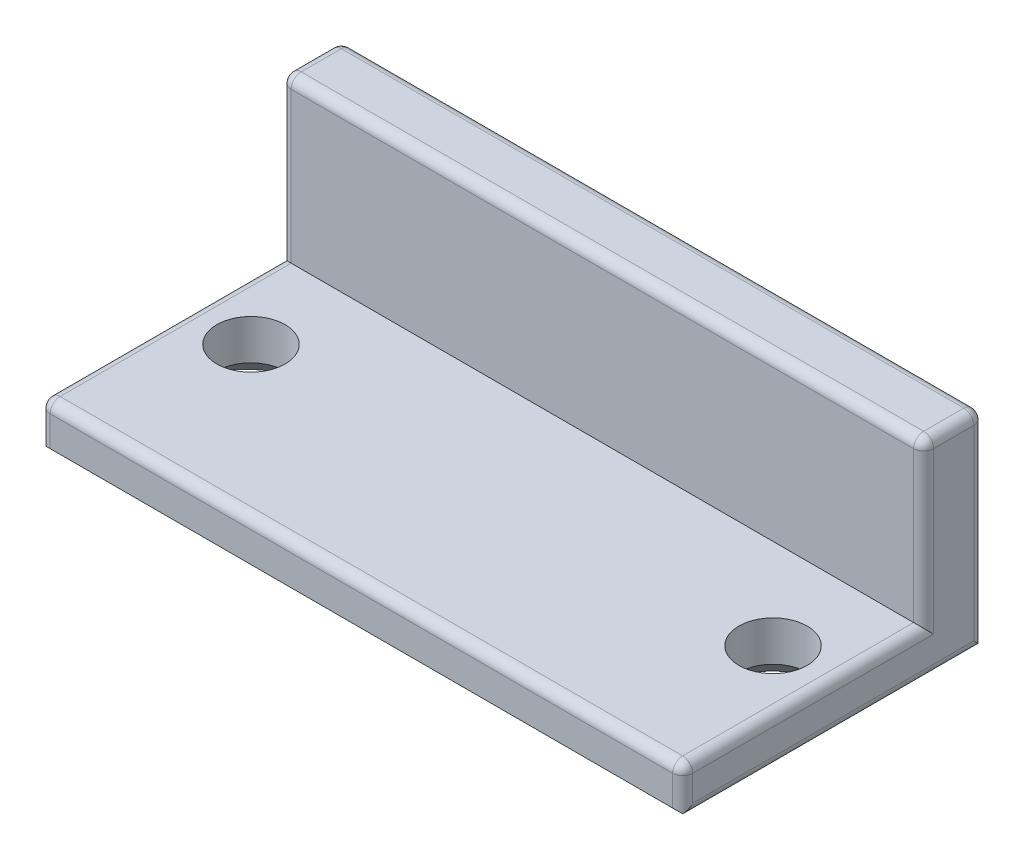
from build123d import *

# Parameters (mm, degrees)
SKETCH_1_W          = 32
SKETCH_1_H          = 15
EXTRUDE_1_DEPTH     = 3
SKETCH_2_W          = 32
SKETCH_2_H          = 3
EXTRUDE_2_DEPTH     = 8
SKETCH_3_R          = 1.7
CUT_EXTRUDE_1_DEPTH = 8
CHAMFER_1_SIZE      = 1
FILLET_1_R          = 0.5
FILLET_2_R          = 0.5


with BuildPart() as part:
    # Эскиз1 → Бобышка-Вытянуть1 (new body)
    with BuildSketch(Plane(origin=(0, 0, 0), x_dir=(1, 0, 0), z_dir=(0, 1, 0))):
        Rectangle(SKETCH_1_W, SKETCH_1_H)
    extrude(amount=EXTRUDE_1_DEPTH)

    # Эскиз2 → Бобышка-Вытянуть2 (add)
    with BuildSketch(Plane(origin=(0, 3, 0), x_dir=(1, 0, 0), z_dir=(0, 1, 0))):
        with Locations((0, 6)):
            Rectangle(SKETCH_2_W, SKETCH_2_H)
    extrude(amount=EXTRUDE_2_DEPTH)

    # Эскиз3 → Вырез-Вытянуть1 (cut)
    with BuildSketch(Plane.XZ):
        with Locations(Location((13, 0, 0), (0, 0, 270))):
            Circle(SKETCH_3_R)
        with Locations(Location((-13, 0, 0), (0, 0, 270))):
            Circle(SKETCH_3_R)
    extrude(amount=-CUT_EXTRUDE_1_DEPTH, mode=Mode.SUBTRACT)

    # Фаска1
    # the kernel refuses this chamfer: 1 mm, written as the material it takes off along each edge
    with BuildSketch(Plane(origin=(13, 0, 0), x_dir=(0, 0, -1), z_dir=(-1, 0, 0))) as chamfer_1_piece_1:
        Polygon((1.7 + CHAMFER_1_SIZE, 0), (1.7, -CHAMFER_1_SIZE), (1.7, 0), align=None)
    revolve(axis=Axis((13, 0, 0), (0, -1, 0)), mode=Mode.SUBTRACT)
    with BuildSketch(Plane(origin=(-13, 0, 0), x_dir=(0, 0, -1), z_dir=(-1, 0, 0))) as chamfer_1_piece_2:
        Polygon((1.7 + CHAMFER_1_SIZE, 0), (1.7, -CHAMFER_1_SIZE), (1.7, 0), align=None)
    revolve(axis=Axis((-13, 0, 0), (0, -1, 0)), mode=Mode.SUBTRACT)
    with BuildSketch(Plane(origin=(-18.571682988, 0, 7.5), x_dir=(0, 0.9996219169112968, 0.027495876610586494), z_dir=(1, 0, 0))) as chamfer_1_piece_3:
        Polygon((CHAMFER_1_SIZE * 0.999621916911, -CHAMFER_1_SIZE * 0.0274958766106), (-CHAMFER_1_SIZE * 0.0274958766106, -CHAMFER_1_SIZE * 0.999621916911), (0, 0), align=None)
    extrude(amount=37.143365976, mode=Mode.SUBTRACT)
    with BuildSketch(Plane(origin=(-16, 0, -10.071682988), x_dir=(-0.02749587661058563, 0.9996219169112968, 0), z_dir=(0, 0, 1)), Plane(origin=(16, 0, 10.071682988), x_dir=(0.02749587661058563, 0.9996219169112968, 0), z_dir=(0, 0, -1))) as chamfer_1_piece_4:
        Polygon((CHAMFER_1_SIZE * 0.999621916911, -CHAMFER_1_SIZE * 0.0274958766106), (-CHAMFER_1_SIZE * 0.0274958766106, -CHAMFER_1_SIZE * 0.999621916911), (0, 0), align=None)
    extrude(amount=20.143365976, mode=Mode.SUBTRACT)
    with BuildSketch(Plane(origin=(18.571682988, 0, -7.5), x_dir=(0, -0.027495876610586365, 0.9996219169112968), z_dir=(-1, 0, 0))) as chamfer_1_piece_5:
        Polygon((CHAMFER_1_SIZE * 0.999621916911, CHAMFER_1_SIZE * 0.0274958766106), (-CHAMFER_1_SIZE * 0.0274958766106, CHAMFER_1_SIZE * 0.999621916911), (0, 0), align=None)
    extrude(amount=37.143365976, mode=Mode.SUBTRACT)

    # Скругление1
    # the kernel refuses this fillet: 0.5 mm, written as the material it takes off along each edge
    with BuildSketch(Plane(origin=(-15.5, 10.5, -5), x_dir=(0, 0, 1), z_dir=(0, 1, 0))) as fillet_1_piece_1_section:
        Polygon((0, 0), (FILLET_1_R, 0), (FILLET_1_R, -FILLET_1_R), (0, -FILLET_1_R), align=None)
    fillet_1_piece_1 = extrude(amount=FILLET_1_R, mode=Mode.PRIVATE)
    fillet_1_piece_1 = fillet_1_piece_1 - Plane(origin=(-15.5, 10.5, -5), x_dir=(0.7071067811865475, 0, -0.7071067811865475), z_dir=(0, 1, 0)) * Sphere(FILLET_1_R, mode=Mode.PRIVATE)
    add(fillet_1_piece_1, mode=Mode.SUBTRACT)
    with BuildSketch(Plane(origin=(15.5, 10.5, -5), x_dir=(1, 0, 0), z_dir=(0, 1, 0))) as fillet_1_piece_2_section:
        Polygon((0, 0), (FILLET_1_R, 0), (FILLET_1_R, -FILLET_1_R), (0, -FILLET_1_R), align=None)
    fillet_1_piece_2 = extrude(amount=FILLET_1_R, mode=Mode.PRIVATE)
    fillet_1_piece_2 = fillet_1_piece_2 - Plane(origin=(15.5, 10.5, -5), x_dir=(-0.7071067811865475, 0, -0.7071067811865475), z_dir=(0, 1, 0)) * Sphere(FILLET_1_R, mode=Mode.PRIVATE)
    add(fillet_1_piece_2, mode=Mode.SUBTRACT)
    with BuildSketch(Plane(origin=(-15.5, 10.5, -7), x_dir=(0, 1, 0), z_dir=(0, 0, -1))) as fillet_1_piece_3_section:
        Polygon((0, 0), (FILLET_1_R, 0), (FILLET_1_R, -FILLET_1_R), (0, -FILLET_1_R), align=None)
    fillet_1_piece_3 = extrude(amount=FILLET_1_R, mode=Mode.PRIVATE)
    fillet_1_piece_3 = fillet_1_piece_3 - Plane(origin=(-15.5, 10.5, -7), x_dir=(0.7071067811865475, -0.7071067811865475, 0), z_dir=(0, 0, -1)) * Sphere(FILLET_1_R, mode=Mode.PRIVATE)
    add(fillet_1_piece_3, mode=Mode.SUBTRACT)
    with BuildSketch(Plane(origin=(15.5, 10.5, -7), x_dir=(0, 1, 0), z_dir=(0, 0, -1))) as fillet_1_piece_4_section:
        Polygon((0, 0), (FILLET_1_R, 0), (FILLET_1_R, FILLET_1_R), (0, FILLET_1_R), align=None)
    fillet_1_piece_4 = extrude(amount=FILLET_1_R, mode=Mode.PRIVATE)
    fillet_1_piece_4 = fillet_1_piece_4 - Plane(origin=(15.5, 10.5, -7), x_dir=(-0.7071067811865475, -0.7071067811865475, 0), z_dir=(0, 0, -1)) * Sphere(FILLET_1_R, mode=Mode.PRIVATE)
    add(fillet_1_piece_4, mode=Mode.SUBTRACT)
    with BuildSketch(Plane(origin=(-16, 3, -4.5), x_dir=(1, 0, 0), z_dir=(0, 0, 1))) as fillet_1_piece_5:
        with BuildLine():
            CenterArc((FILLET_1_R, -FILLET_1_R), FILLET_1_R, 90, 90)
            Line((0, -FILLET_1_R), (0, 0))
            Line((0, 0), (FILLET_1_R, 0))
        make_face()
    extrude(amount=13.25, mode=Mode.SUBTRACT)
    with BuildSketch(Plane(origin=(-16, 3, -4.5), x_dir=(0, 0, -1), z_dir=(0, 1, 0))) as fillet_1_piece_6:
        with BuildLine():
            CenterArc((FILLET_1_R, -FILLET_1_R), FILLET_1_R, 90, 90)
            Line((0, -FILLET_1_R), (0, 0))
            Line((0, 0), (FILLET_1_R, 0))
        make_face()
    extrude(amount=7.5, mode=Mode.SUBTRACT)
    with BuildSketch(Plane(origin=(16, 3, -4.5), x_dir=(0, 0, -1), z_dir=(0, 1, 0))) as fillet_1_piece_7:
        with BuildLine():
            CenterArc((FILLET_1_R, FILLET_1_R), FILLET_1_R, 180, 90)
            Line((0, FILLET_1_R), (0, 0))
            Line((0, 0), (FILLET_1_R, 0))
        make_face()
    extrude(amount=7.5, mode=Mode.SUBTRACT)
    with BuildSketch(Plane(origin=(-16, 11, -5), x_dir=(0, -1, 0), z_dir=(0, 0, -1)), Plane(origin=(16, 11, -7), x_dir=(0, -1, 0), z_dir=(0, 0, 1))) as fillet_1_piece_8:
        with BuildLine():
            CenterArc((FILLET_1_R, -FILLET_1_R), FILLET_1_R, 90, 90)
            Line((0, -FILLET_1_R), (0, 0))
            Line((0, 0), (FILLET_1_R, 0))
        make_face()
    extrude(amount=2, mode=Mode.SUBTRACT)
    with BuildSketch(Plane(origin=(15.5, 11, -4.5), x_dir=(0, 0, -1), z_dir=(-1, 0, 0))) as fillet_1_piece_9:
        with BuildLine():
            CenterArc((FILLET_1_R, FILLET_1_R), FILLET_1_R, 180, 90)
            Line((0, FILLET_1_R), (0, 0))
            Line((0, 0), (FILLET_1_R, 0))
        make_face()
    extrude(amount=31, mode=Mode.SUBTRACT)
    with BuildSketch(Plane(origin=(-15.5, 11, -7.5), x_dir=(0, -1, 0), z_dir=(1, 0, 0))) as fillet_1_piece_10:
        with BuildLine():
            CenterArc((FILLET_1_R, -FILLET_1_R), FILLET_1_R, 90, 90)
            Line((0, -FILLET_1_R), (0, 0))
            Line((0, 0), (FILLET_1_R, 0))
        make_face()
    extrude(amount=31, mode=Mode.SUBTRACT)
    with BuildSketch(Plane(origin=(-16, 1, -8.017766953), x_dir=(0, 1, 0), z_dir=(0, 0, 1)), Plane(origin=(16, 1, 8.017766953), x_dir=(0, 1, 0), z_dir=(0, 0, -1))) as fillet_1_piece_11:
        with BuildLine():
            CenterArc((FILLET_1_R * 0.414213562373, -FILLET_1_R), FILLET_1_R, 90, 45)
            Line((-FILLET_1_R * 0.292893218814, -FILLET_1_R * 0.292893218814), (0, 0))
            Line((0, 0), (FILLET_1_R * 0.414213562373, 0))
        make_face()
    extrude(amount=16.035533906, mode=Mode.SUBTRACT)
    with BuildSketch(Plane(origin=(16, 3, 8.75), x_dir=(0, -1, 0), z_dir=(0, 0, -1))) as fillet_1_piece_12:
        with BuildLine():
            CenterArc((FILLET_1_R, FILLET_1_R), FILLET_1_R, 180, 90)
            Line((0, FILLET_1_R), (0, 0))
            Line((0, 0), (FILLET_1_R, 0))
        make_face()
    extrude(amount=13.25, mode=Mode.SUBTRACT)
    with BuildSketch(Plane(origin=(16, -0.25, 7.5), x_dir=(-1, 0, 0), z_dir=(0, 1, 0))) as fillet_1_piece_13:
        with BuildLine():
            CenterArc((FILLET_1_R, -FILLET_1_R), FILLET_1_R, 90, 90)
            Line((0, -FILLET_1_R), (0, 0))
            Line((0, 0), (FILLET_1_R, 0))
        make_face()
    extrude(amount=4.5, mode=Mode.SUBTRACT)
    with BuildSketch(Plane(origin=(-16, -0.25, 7.5), x_dir=(1, 0, 0), z_dir=(0, 1, 0))) as fillet_1_piece_14:
        with BuildLine():
            CenterArc((FILLET_1_R, FILLET_1_R), FILLET_1_R, 180, 90)
            Line((0, FILLET_1_R), (0, 0))
            Line((0, 0), (FILLET_1_R, 0))
        make_face()
    extrude(amount=4.5, mode=Mode.SUBTRACT)
    with BuildSketch(Plane(origin=(-16, 10.5, -7.5), x_dir=(0, 0, 1), z_dir=(0, -1, 0)), Plane(origin=(16, -0.25, -7.5), x_dir=(0, 0, 1), z_dir=(0, 1, 0))) as fillet_1_piece_15:
        with BuildLine():
            CenterArc((FILLET_1_R, -FILLET_1_R), FILLET_1_R, 90, 90)
            Line((0, -FILLET_1_R), (0, 0))
            Line((0, 0), (FILLET_1_R, 0))
        make_face()
    extrude(amount=10.75, mode=Mode.SUBTRACT)
    with BuildSketch(Plane(origin=(-16, 3, -5.75), x_dir=(1, 0, 0), z_dir=(0, 0, 1))) as fillet_1_piece_16a_section:
        with BuildLine():
            CenterArc((FILLET_1_R, -FILLET_1_R), FILLET_1_R, 90, 90)
            Line((0, -FILLET_1_R), (0, 0))
            Line((0, 0), (FILLET_1_R, 0))
        make_face()
    fillet_1_piece_16a = extrude(amount=14.5, mode=Mode.PRIVATE)
    fillet_1_piece_16a = split(fillet_1_piece_16a, bisect_by=Plane(origin=(-15.886802443, 2.886802443, -4.5), z_dir=(0, 0, -1)), keep=Keep.TOP, mode=Mode.PRIVATE)
    with BuildSketch(Plane(origin=(-16, 1.75, -4.5), x_dir=(0, 0, -1), z_dir=(0, 1, 0))) as fillet_1_piece_16b_section:
        with BuildLine():
            CenterArc((FILLET_1_R, -FILLET_1_R), FILLET_1_R, 90, 90)
            Line((0, -FILLET_1_R), (0, 0))
            Line((0, 0), (FILLET_1_R, 0))
        make_face()
    fillet_1_piece_16b = extrude(amount=8.75, mode=Mode.PRIVATE)
    fillet_1_piece_16b = split(fillet_1_piece_16b, bisect_by=Plane(origin=(-15.886802443, 3, -4.613197557), z_dir=(0, -1, 0)), keep=Keep.TOP, mode=Mode.PRIVATE)
    fillet_1_piece_16 = fillet_1_piece_16a & fillet_1_piece_16b
    add(fillet_1_piece_16, mode=Mode.SUBTRACT)
    with BuildSketch(Plane(origin=(16, 1.75, -4.5), x_dir=(0, 0, -1), z_dir=(0, 1, 0))) as fillet_1_piece_17a_section:
        with BuildLine():
            CenterArc((FILLET_1_R, FILLET_1_R), FILLET_1_R, 180, 90)
            Line((0, FILLET_1_R), (0, 0))
            Line((0, 0), (FILLET_1_R, 0))
        make_face()
    fillet_1_piece_17a = extrude(amount=8.75, mode=Mode.PRIVATE)
    fillet_1_piece_17a = split(fillet_1_piece_17a, bisect_by=Plane(origin=(15.886802443, 3, -4.613197557), z_dir=(0, -1, 0)), keep=Keep.TOP, mode=Mode.PRIVATE)
    with BuildSketch(Plane(origin=(16, 3, 8.75), x_dir=(0, -1, 0), z_dir=(0, 0, -1))) as fillet_1_piece_17b_section:
        with BuildLine():
            CenterArc((FILLET_1_R, FILLET_1_R), FILLET_1_R, 180, 90)
            Line((0, FILLET_1_R), (0, 0))
            Line((0, 0), (FILLET_1_R, 0))
        make_face()
    fillet_1_piece_17b = extrude(amount=14.5, mode=Mode.PRIVATE)
    fillet_1_piece_17b = split(fillet_1_piece_17b, bisect_by=Plane(origin=(15.886802443, 2.886802443, -4.5), z_dir=(0, 0, -1)), keep=Keep.TOP, mode=Mode.PRIVATE)
    fillet_1_piece_17 = fillet_1_piece_17a & fillet_1_piece_17b
    add(fillet_1_piece_17, mode=Mode.SUBTRACT)

    # Скругление2
    # the kernel refuses this fillet: 0.5 mm, written as the material it takes off along each edge
    with BuildSketch(Plane(origin=(-15.5, 2.5, 7), x_dir=(0, 1, 0), z_dir=(0, 0, 1))) as fillet_2_piece_1_section:
        Polygon((0, 0), (FILLET_2_R, 0), (FILLET_2_R, FILLET_2_R), (0, FILLET_2_R), align=None)
    fillet_2_piece_1 = extrude(amount=FILLET_2_R, mode=Mode.PRIVATE)
    fillet_2_piece_1 = fillet_2_piece_1 - Plane(origin=(-15.5, 2.5, 7), x_dir=(0.7071067811865475, -0.7071067811865475, 0), z_dir=(0, 0, 1)) * Sphere(FILLET_2_R, mode=Mode.PRIVATE)
    add(fillet_2_piece_1, mode=Mode.SUBTRACT)
    with BuildSketch(Plane(origin=(15.5, 2.5, 7), x_dir=(0, 1, 0), z_dir=(0, 0, 1))) as fillet_2_piece_2_section:
        Polygon((0, 0), (FILLET_2_R, 0), (FILLET_2_R, -FILLET_2_R), (0, -FILLET_2_R), align=None)
    fillet_2_piece_2 = extrude(amount=FILLET_2_R, mode=Mode.PRIVATE)
    fillet_2_piece_2 = fillet_2_piece_2 - Plane(origin=(15.5, 2.5, 7), x_dir=(-0.7071067811865475, -0.7071067811865475, 0), z_dir=(0, 0, 1)) * Sphere(FILLET_2_R, mode=Mode.PRIVATE)
    add(fillet_2_piece_2, mode=Mode.SUBTRACT)
    with BuildSketch(Plane(origin=(-15.5, 3, 7.5), x_dir=(0, -1, 0), z_dir=(1, 0, 0))) as fillet_2_piece_3:
        with BuildLine():
            CenterArc((FILLET_2_R, FILLET_2_R), FILLET_2_R, 180, 90)
            Line((0, FILLET_2_R), (0, 0))
            Line((0, 0), (FILLET_2_R, 0))
        make_face()
    extrude(amount=31, mode=Mode.SUBTRACT)


solid = part.part
